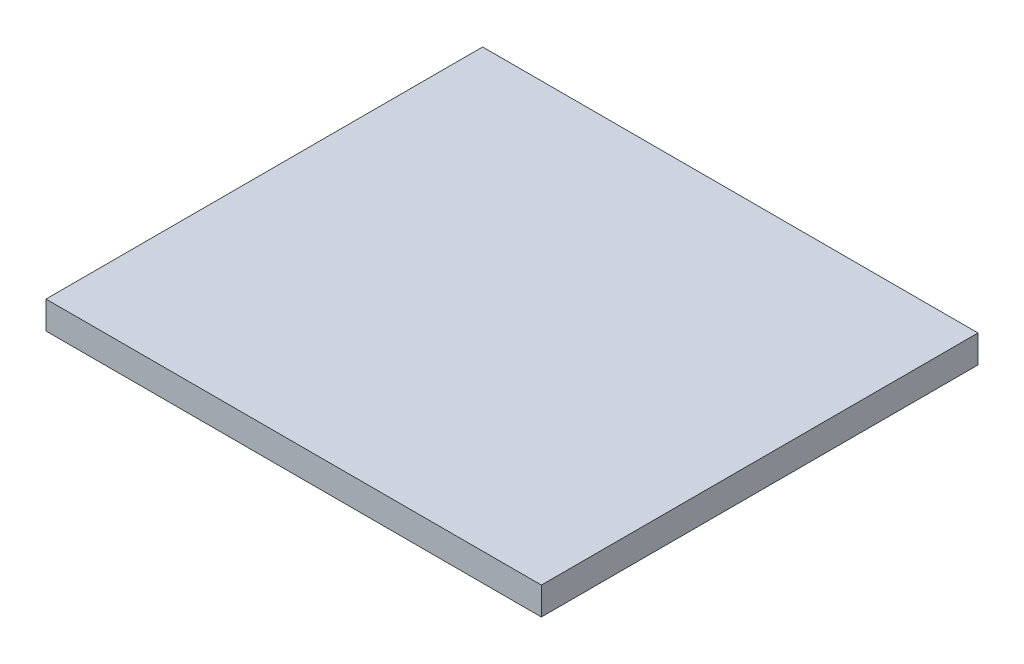
from build123d import *

# Parameters (mm, degrees)
SKETCH1_W           = 113.538
SKETCH1_H           = 100.076
BOSS_EXTRUDE1_DEPTH = 6.35


with BuildPart() as part:
    # Sketch1 → Boss-Extrude1 (new body)
    with BuildSketch(Plane(origin=(0, 0, 0), x_dir=(1, 0, 0), z_dir=(0, 1, 0))):
        with Locations((56.769, 50.038)):
            Rectangle(SKETCH1_W, SKETCH1_H)
    extrude(amount=BOSS_EXTRUDE1_DEPTH)


solid = part.part
